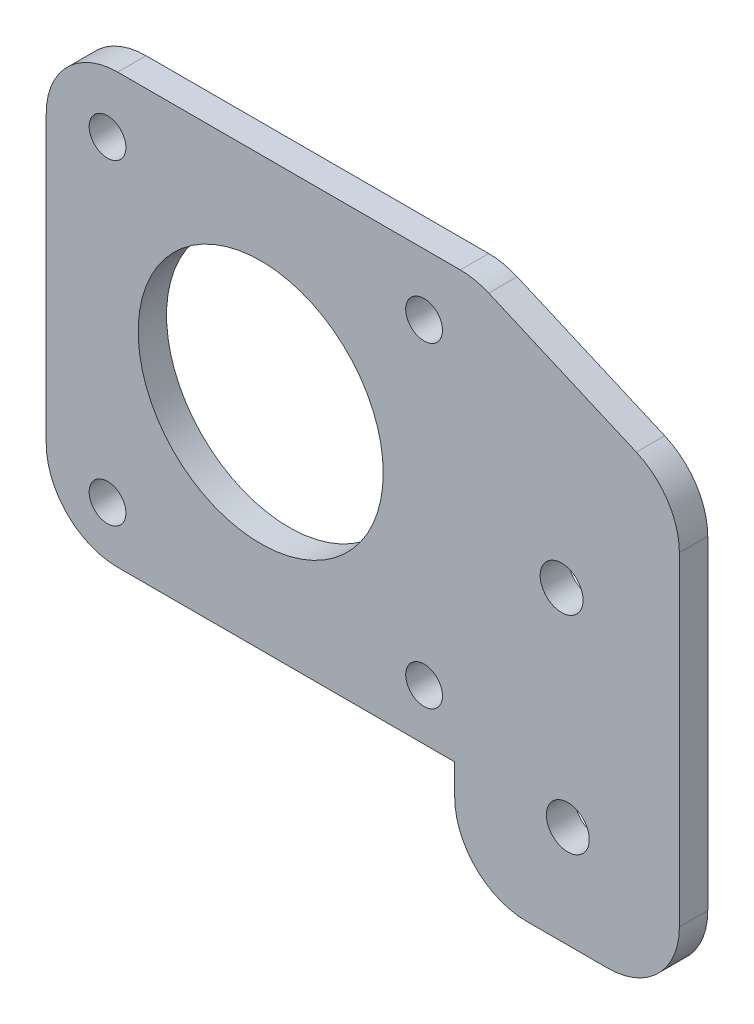
from build123d import *

# Parameters (mm, degrees)
SKETCH1_W           = 62
SKETCH1_H           = 52
BOSS_EXTRUDE1_DEPTH = 2.778125
CUT_EXTRUDE1_DEPTH  = 10
SKETCH2_W           = 40
SKETCH2_H           = 10
CUT_EXTRUDE2_DEPTH  = 10
FILLET1_R           = 7
FILLET2_R           = 7
SKETCH4_R           = 2.1
SKETCH4_R_2         = 1.8
SKETCH4_R_3         = 12
CUT_EXTRUDE3_DEPTH  = 10


with BuildPart() as part:
    # Sketch1 → Boss-Extrude1 (new body)
    with BuildSketch(Plane.XY):
        with Locations((-31, 4.465517241)):
            Rectangle(SKETCH1_W, SKETCH1_H)
    extrude(amount=BOSS_EXTRUDE1_DEPTH)

    # Sketch3 → Cut-Extrude1 (cut)
    with BuildSketch(Plane.XY.offset(2.778125)):
        Polygon((-20, 30.465517241), (0, 21.802451622), (0, 30.465517241), align=None)
    extrude(amount=-CUT_EXTRUDE1_DEPTH, mode=Mode.SUBTRACT)

    # Sketch2 → Cut-Extrude2 (cut)
    with BuildSketch(Plane.XY.offset(2.778125)):
        with Locations((-42, -16.534482759)):
            Rectangle(SKETCH2_W, SKETCH2_H)
    extrude(amount=-CUT_EXTRUDE2_DEPTH, mode=Mode.SUBTRACT)

    # Fillet1
    fillet1_edges = [part.edges().sort_by_distance(p)[0] for p in [
        (0, -21.534482759, 1.3890625),
        (-22, -21.534482759, 1.3890625),
        (-62, -11.534482759, 1.3890625),
        (-62, 30.465517241, 1.3890625),
    ]]
    fillet(fillet1_edges, radius=FILLET1_R)

    # Fillet2
    fillet2_edges = [part.edges().sort_by_distance(p)[0] for p in [
        (-20, 30.465517241, 1.3890625),
        (0, 21.802451622, 1.3890625),
    ]]
    fillet(fillet2_edges, radius=FILLET2_R)

    # Sketch4 → Cut-Extrude3 (cut)
    with BuildSketch(Plane.XY.offset(2.778125)):
        with Locations((-10.925971148, -11.534482759)):
            Circle(SKETCH4_R)
        with Locations((-11.533537591, 8.465517241)):
            Circle(SKETCH4_R)
        with Locations((-56, -6.534482759)):
            Circle(SKETCH4_R_2)
        with Locations((-56, 24.465517241)):
            Circle(SKETCH4_R_2)
        with Locations((-25, 24.465517241)):
            Circle(SKETCH4_R_2)
        with Locations((-25, -6.534482759)):
            Circle(SKETCH4_R_2)
        with Locations((-41, 9.468169555)):
            Circle(SKETCH4_R_3)
    extrude(amount=-CUT_EXTRUDE3_DEPTH, mode=Mode.SUBTRACT)


solid = part.part
